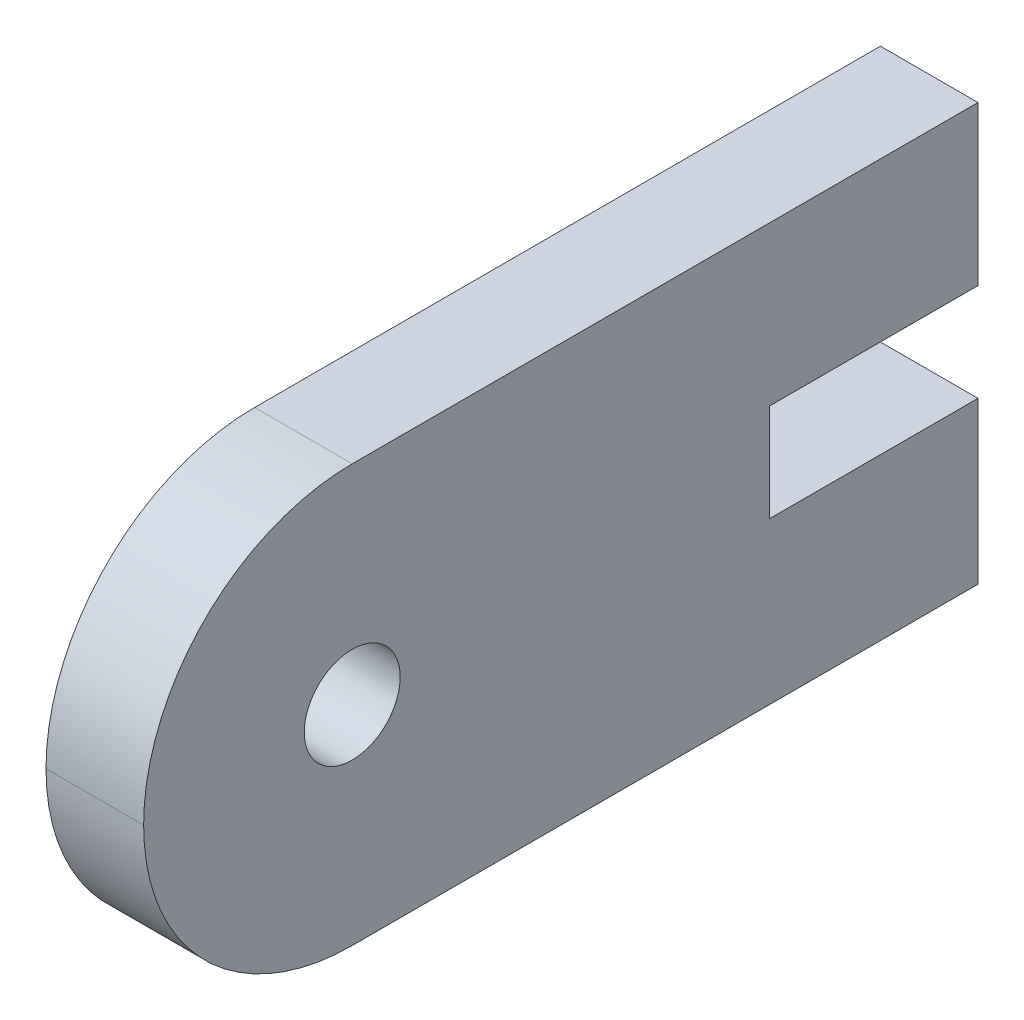
from build123d import *

# Parameters (mm, degrees)
SKETCH1_W           = 12.7
SKETCH1_H           = 25.4
SKETCH1_R           = 1.4605
BOSS_EXTRUDE1_DEPTH = 2.9718
SKETCH2_W           = 2.9718
SKETCH2_H           = 6.35
CUT_EXTRUDE1_DEPTH  = 15.506691395
FILLET3_R           = 6.35


with BuildPart() as part:
    # Sketch1 → Boss-Extrude1 (new body)
    with BuildSketch(Plane.YZ):
        Rectangle(SKETCH1_W, SKETCH1_H)
        with Locations(Location((0, 6.35, 0), (0, 0, 270))):
            Circle(SKETCH1_R, mode=Mode.SUBTRACT)
    extrude(amount=BOSS_EXTRUDE1_DEPTH)

    # Sketch2 → Cut-Extrude1 (cut, through all)
    with BuildSketch(Plane.YZ.offset(2.9718)):
        with Locations((0.037070408, -9.525)):
            Rectangle(SKETCH2_W, SKETCH2_H)
    extrude(amount=-CUT_EXTRUDE1_DEPTH, mode=Mode.SUBTRACT)

    # Fillet3
    fillet3_edges = [part.edges().sort_by_distance(p)[0] for p in [
        (1.4859, -6.35, 12.7),
        (1.4859, 6.35, 12.7),
    ]]
    fillet(fillet3_edges, radius=FILLET3_R - 0.0001)  # a hair under: the kernel refuses the full size


solid = part.part
